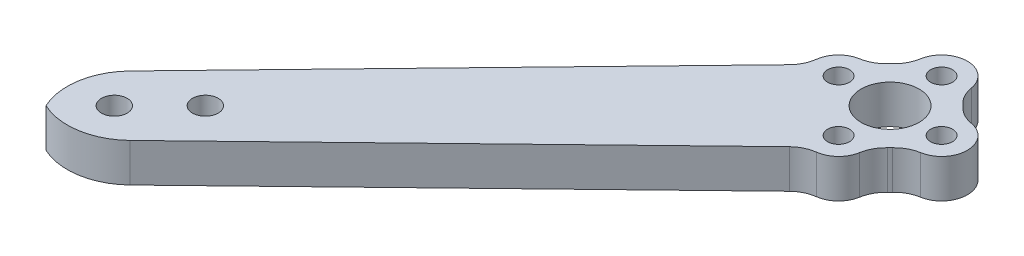
from build123d import *

# Parameters (mm, degrees)
SKETCH2_R               = 1.7
SKETCH2_R_2             = 4.5
BOSS_EXTRUDE1_DEPTH     = 6
FILLET1_R               = 10
CUT_EXTRUDE2_DEPTH      = 138.309868546
CUT_EXTRUDE2_DEPTH_BACK = 138.309868546
SKETCH7_R               = 2


with BuildPart() as part:
    # Sketch2 → Boss-Extrude1 (new body)
    with BuildSketch(Plane(origin=(0, 0, 0), x_dir=(1, 0, 0), z_dir=(0, 1, 0))):
        with BuildLine():
            Line((82.701229094, 71.670763572), (23.580603164, 14.468001358))
            Line((23.580603164, 14.468001358), (14.468001358, 23.580603164))
            Line((14.468001358, 23.580603164), (71.670763572, 82.701229094))
            ThreePointArc((71.670763572, 82.701229094), (72.579468699, 84.002771186), (73.034411761, 85.523555075))
            ThreePointArc((73.034411761, 85.523555075), (74.120868496, 87.776797037), (76.333333333, 88.944053189))
            ThreePointArc((76.333333333, 88.944053189), (77.868327334, 89.470595445), (79.153846154, 90.460996723))
            ThreePointArc((79.153846154, 90.460996723), (79.343145751, 90.656854249), (79.539003277, 90.846153846))
            ThreePointArc((79.539003277, 90.846153846), (80.529404555, 92.131672666), (81.055946811, 93.666666667))
            ThreePointArc((81.055946811, 93.666666667), (85, 97), (88.944053189, 93.666666667))
            ThreePointArc((88.944053189, 93.666666667), (89.470595445, 92.131672666), (90.460996723, 90.846153846))
            ThreePointArc((90.460996723, 90.846153846), (90.656854249, 90.656854249), (90.846153846, 90.460996723))
            ThreePointArc((90.846153846, 90.460996723), (92.131672666, 89.470595445), (93.666666667, 88.944053189))
            ThreePointArc((93.666666667, 88.944053189), (97, 85), (93.666666667, 81.055946811))
            ThreePointArc((93.666666667, 81.055946811), (92.131672666, 80.529404555), (90.846153846, 79.539003277))
            ThreePointArc((90.846153846, 79.539003277), (90.656854249, 79.343145751), (90.460996723, 79.153846154))
            ThreePointArc((90.460996723, 79.153846154), (89.470595445, 77.868327334), (88.944053189, 76.333333333))
            ThreePointArc((88.944053189, 76.333333333), (87.776797037, 74.120868496), (85.523555075, 73.034411761))
            ThreePointArc((85.523555075, 73.034411761), (84.002771186, 72.579468699), (82.701229094, 71.670763572))
        make_face()
        with Locations(Location((85, 93, 0), (0, 0, 270))):
            Circle(SKETCH2_R, mode=Mode.SUBTRACT)
        with Locations(Location((93, 85, 0), (0, 0, 270))):
            Circle(SKETCH2_R, mode=Mode.SUBTRACT)
        with Locations(Location((85, 77, 0), (0, 0, 270))):
            Circle(SKETCH2_R, mode=Mode.SUBTRACT)
        with Locations(Location((77, 85, 0), (0, 0, 270))):
            Circle(SKETCH2_R, mode=Mode.SUBTRACT)
        with Locations(Location((85, 85, 0), (0, 0, 270))):
            Circle(SKETCH2_R_2, mode=Mode.SUBTRACT)
    extrude(amount=BOSS_EXTRUDE1_DEPTH)

    # Fillet1
    # the kernel refuses this fillet: 10 mm, written as the material it takes off along each edge
    with BuildSketch(Plane(origin=(23.580603164, -24.591214075, -14.468001358), x_dir=(0.71866742198992, 0, -0.6953539649490483), z_dir=(0, 1, 0)), Plane(origin=(14.468001358, -24.591214075, -23.580603164), x_dir=(0.7071067811865477, 0, 0.7071067811865475), z_dir=(0, 1, 0))) as fillet1_piece_1:
        with BuildLine():
            CenterArc((FILLET1_R * 0.983648563013, FILLET1_R), FILLET1_R, 180.944569645, 89.055430355)
            Line((-FILLET1_R * 0.0162155484343, FILLET1_R * 0.983514896433), (0, 0))
            Line((0, 0), (FILLET1_R * 0.983648563013, 0))
        make_face()
    extrude(amount=55.182428151, mode=Mode.SUBTRACT)

    # Sketch7 → Cut-Extrude2 (cut, two sides: drawn at the far end of the back side and taken through both)
    with BuildSketch(Plane(origin=(0, 0, 0), x_dir=(1, 0, 0), z_dir=(0, 1, 0)).offset(-CUT_EXTRUDE2_DEPTH_BACK)):
        with Locations(Location((24.748737342, 24.748737342, 0), (0, 0, 270))):
            Circle(SKETCH7_R)
        with Locations(Location((31.819805153, 31.819805153, 0), (0, 0, 270))):
            Circle(SKETCH7_R)
    extrude(amount=CUT_EXTRUDE2_DEPTH + CUT_EXTRUDE2_DEPTH_BACK, mode=Mode.SUBTRACT)


solid = part.part
